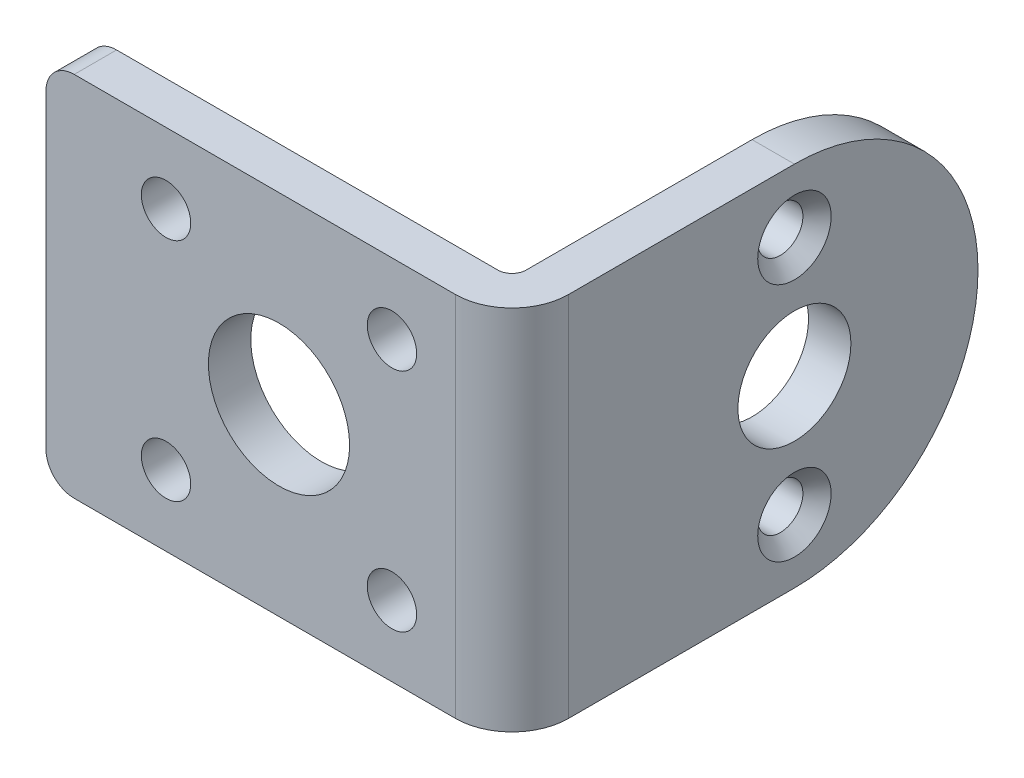
from build123d import *

# Parameters (mm, degrees)
BOSS_EXTRUDE1_DEPTH = 26
SKETCH2_R           = 5
SKETCH2_R_2         = 1.75
CUT_EXTRUDE1_DEPTH  = 26
FILLET1_R           = 13
SKETCH4_R           = 4
SKETCH4_R_2         = 1.6
CUT_EXTRUDE2_DEPTH  = 26
FILLET2_R           = 1
FILLET3_R           = 4
FILLET4_R           = 2
CHAMFER1_SIZE       = 1


with BuildPart() as part:
    # Sketch1 → Boss-Extrude1 (new body)
    with BuildSketch(Plane(origin=(0, 0, 0), x_dir=(1, 0, 0), z_dir=(0, 1, 0))):
        Polygon((0, 0), (0, 33), (-3, 33), (-3, 3), (-33, 3), (-33, 0), align=None)
    extrude(amount=BOSS_EXTRUDE1_DEPTH)

    # Sketch2 → Cut-Extrude1 (cut)
    with BuildSketch(Plane.XY):
        with Locations((-16.5, 13)):
            Circle(SKETCH2_R)
        with Locations((-24.5, 21)):
            Circle(SKETCH2_R_2)
        with Locations((-8.5, 21)):
            Circle(SKETCH2_R_2)
        with Locations((-8.5, 5)):
            Circle(SKETCH2_R_2)
        with Locations((-24.5, 5)):
            Circle(SKETCH2_R_2)
    extrude(amount=-CUT_EXTRUDE1_DEPTH, mode=Mode.SUBTRACT)

    # Fillet1
    fillet1_edges = [part.edges().sort_by_distance(p)[0] for p in [
        (-1.5, 0, -33),
        (-1.5, 26, -33),
    ]]
    fillet(fillet1_edges, radius=FILLET1_R - 0.0001)  # a hair under: the kernel refuses the full size

    # Sketch4 → Cut-Extrude2 (cut)
    with BuildSketch(Plane(origin=(0, 0, 0), x_dir=(0, 0, -1), z_dir=(1, 0, 0))):
        with Locations((20, 13)):
            Circle(SKETCH4_R)
        with Locations((20, 21.5)):
            Circle(SKETCH4_R_2)
        with Locations((20, 4.5)):
            Circle(SKETCH4_R_2)
    extrude(amount=-CUT_EXTRUDE2_DEPTH, mode=Mode.SUBTRACT)

    # Fillet2
    fillet2_edges = [part.edges().sort_by_distance(p)[0] for p in [
        (-3, 13, -3),
    ]]
    fillet(fillet2_edges, radius=FILLET2_R)

    # Fillet3
    fillet3_edges = [part.edges().sort_by_distance(p)[0] for p in [
        (0, 13, 0),
    ]]
    fillet(fillet3_edges, radius=FILLET3_R)

    # Fillet4
    fillet4_edges = [part.edges().sort_by_distance(p)[0] for p in [
        (-33, 26, -1.5),
        (-33, 0, -1.5),
    ]]
    fillet(fillet4_edges, radius=FILLET4_R)

    # Chamfer1
    chamfer1_edges = [part.edges().sort_by_distance(p)[0] for p in [
        (0, 4.5, -18.4),
        (0, 21.5, -18.4),
    ]]
    chamfer(chamfer1_edges, length=CHAMFER1_SIZE)


solid = part.part
